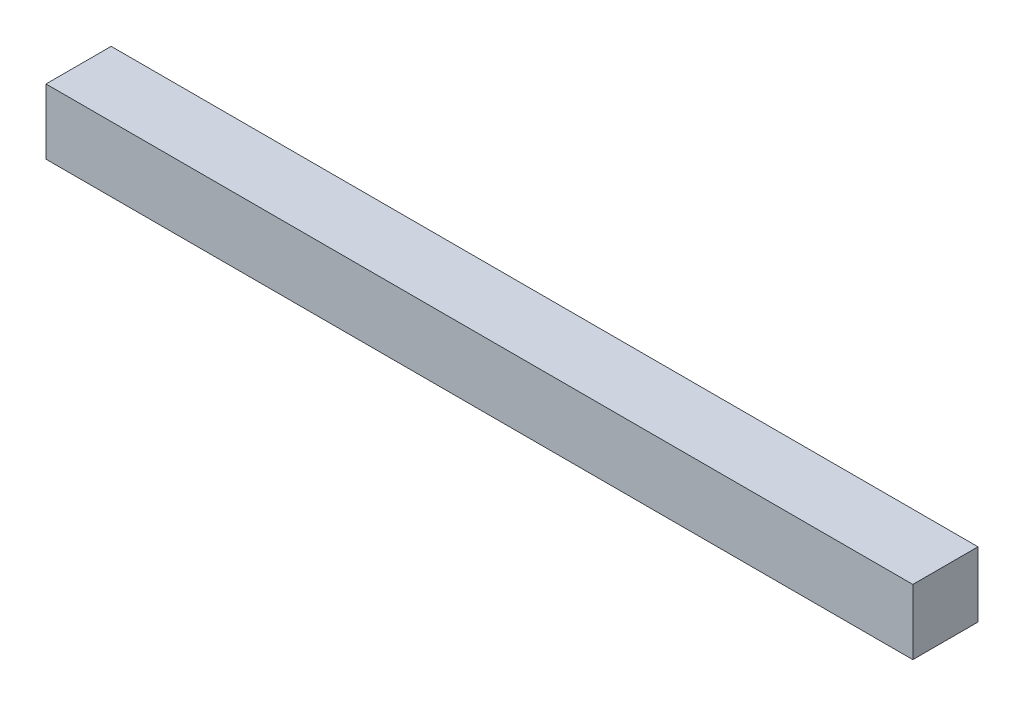
from build123d import *

# Parameters (mm, degrees)
ESQUISSE1_W        = 133
ESQUISSE1_H        = 10
BOSS_EXTRU_1_DEPTH = 10


with BuildPart() as part:
    # Esquisse1 → Boss.-Extru.1 (new body)
    with BuildSketch(Plane.XY):
        with Locations((-4.10685118, 35.172413793)):
            Rectangle(ESQUISSE1_W, ESQUISSE1_H)
    extrude(amount=BOSS_EXTRU_1_DEPTH)


solid = part.part
